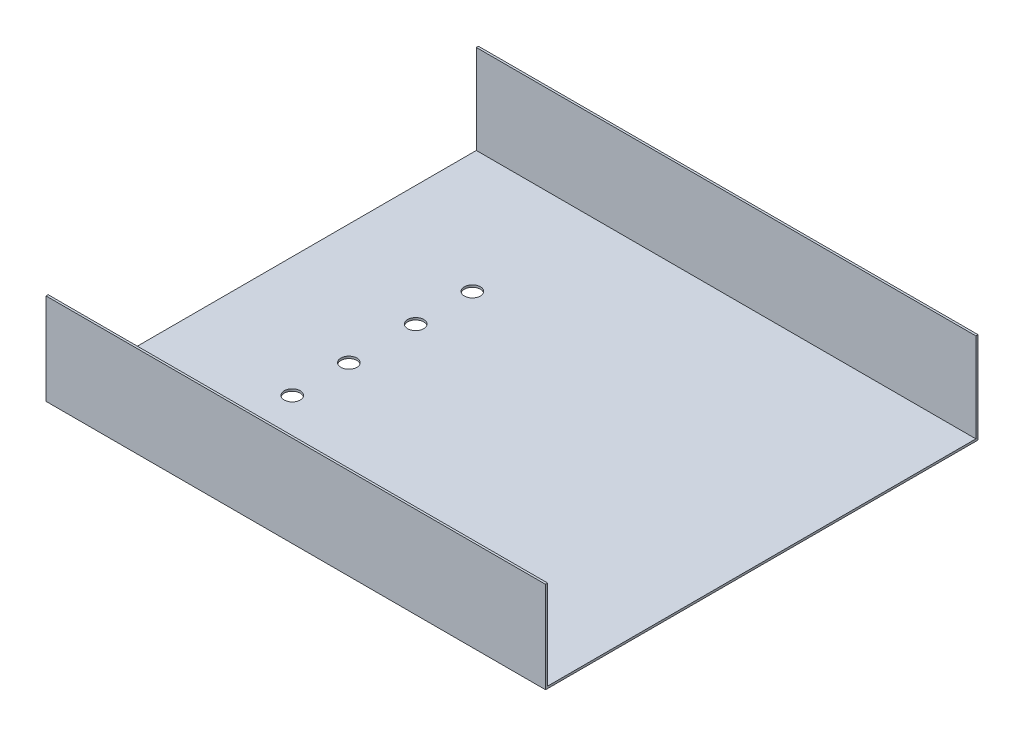
from build123d import *

# Parameters (mm, degrees)
CROQUIS1_W                   = 120
CROQUIS1_H                   = 25
SALIENTE_EXTRUIR1_DEPTH      = 140
VACIADO1_T                   = 0.6
TALADRO_DE_MARGEN_PARA_M41_D = 4.5


with BuildPart() as part:
    # Croquis1 → Saliente-Extruir1 (new body)
    with BuildSketch(Plane(origin=(0, 0, 0), x_dir=(0, 0, -1), z_dir=(1, 0, 0))):
        with Locations((60, 12.5)):
            Rectangle(CROQUIS1_W, CROQUIS1_H)
    extrude(amount=SALIENTE_EXTRUIR1_DEPTH)

    # Vaciado1
    vaciado1_openings = [part.faces().sort_by_distance(p)[0] for p in [
        (0, 12.5, -60),
        (140, 12.5, -60),
        (70, 25, -60),
    ]]
    offset(amount=VACIADO1_T, openings=vaciado1_openings, kind=Kind.INTERSECTION)

    # Taladro de margen para M41 (through all)
    with Locations(Plane(origin=(83.259459275, 0, -172.630862631), x_dir=(1, 0, 0), z_dir=(0, 1, 0))):
        with Locations((-49.609448194, -137.868370051), (-49.609459275, -87.393362631), (-49.609459275, -103.268362631), (-49.609448194, -121.993370051)):
            Hole(TALADRO_DE_MARGEN_PARA_M41_D / 2)


solid = part.part
